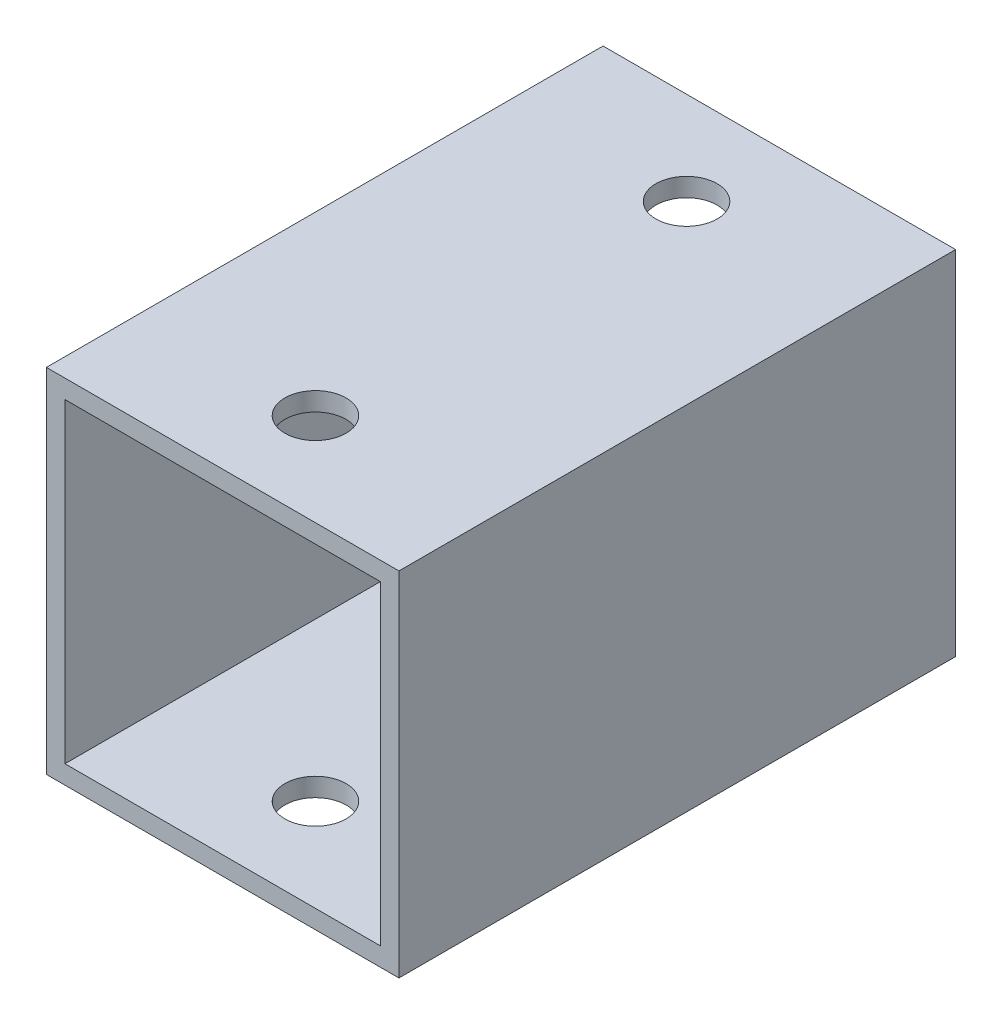
from build123d import *

# Parameters (mm, degrees)
ESBO_O1_W                = 19
ESBO_O1_H                = 19
RESSALTO_EXTRUS_O1_DEPTH = 30
CASCA1_T                 = -1
ESBO_O2_R                = 1.65
CORTE_EXTRUS_O1_DEPTH    = 41.274061131


with BuildPart() as part:
    # Esboço1 → Ressalto-extrusão1 (new body)
    with BuildSketch(Plane.XY):
        with Locations((9.5, 9.5)):
            Rectangle(ESBO_O1_W, ESBO_O1_H)
    extrude(amount=RESSALTO_EXTRUS_O1_DEPTH)

    # Casca1
    casca1_openings = [part.faces().sort_by_distance(p)[0] for p in [
        (9.5, 9.5, 0),
        (9.5, 9.5, 30),
    ]]
    offset(amount=CASCA1_T, openings=casca1_openings, kind=Kind.INTERSECTION)

    # Esboço2 → Corte-extrusão1 (cut, through all)
    with BuildSketch(Plane(origin=(0, 19, 0), x_dir=(1, 0, 0), z_dir=(0, 1, 0))):
        with Locations((9.5, -25)):
            Circle(ESBO_O2_R)
        with Locations((9.5, -5)):
            Circle(ESBO_O2_R)
    extrude(amount=-CORTE_EXTRUS_O1_DEPTH, mode=Mode.SUBTRACT)


solid = part.part
